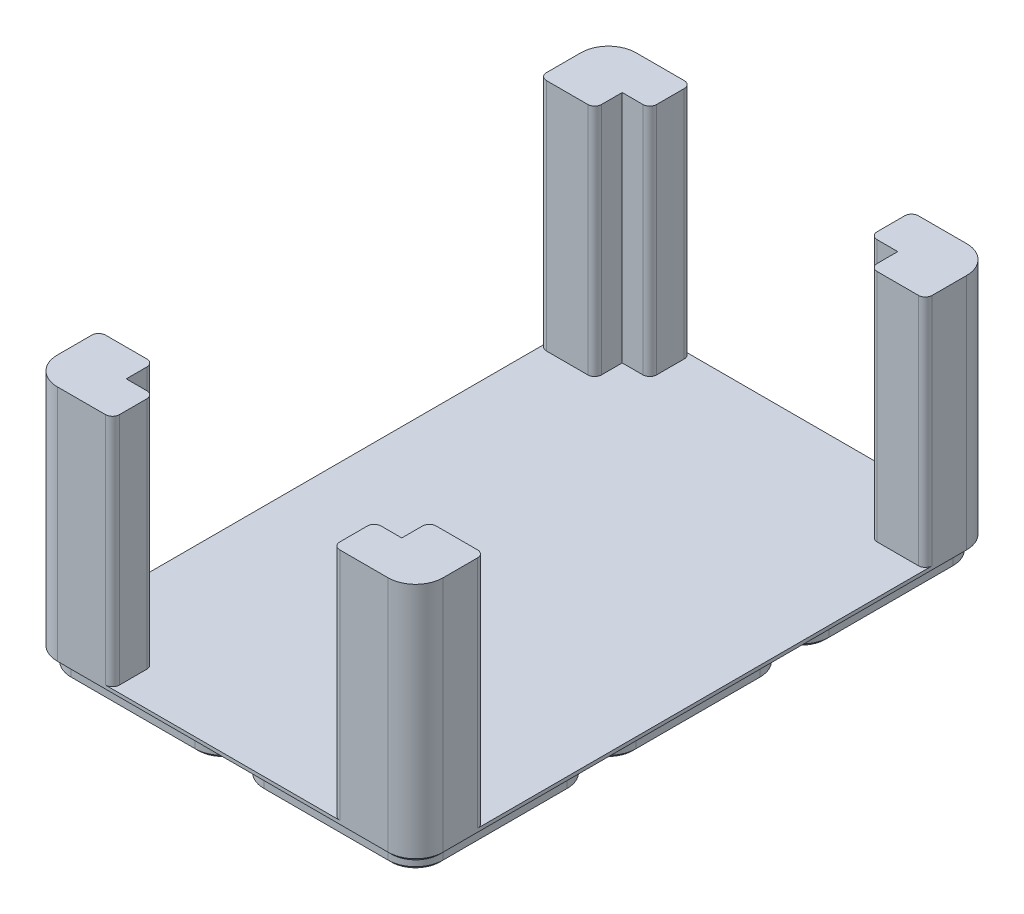
from build123d import *

# Parameters (mm, degrees)
BOSS_EXTRUDE4_DEPTH = 5
SKETCH7_R           = 3
CUT_EXTRUDE4_DEPTH  = 2
SKETCH8_W           = 70
SKETCH8_H           = 70
BOSS_EXTRUDE5_DEPTH = 30
MIRROR2_START       = 5
MIRROR2_OUTLINE_W   = 70
MIRROR2_OUTLINE_H   = 70
MIRROR2_DEPTH       = 30
MIRROR2_2_OUTLINE_R = 3
MIRROR2_2_DEPTH     = 5
MIRROR2_START_2     = 2
MIRROR2_3_OUTLINE_R = 3
MIRROR2_3_DEPTH     = 3
FILLET1_R           = 10
CUT_EXTRUDE5_DEPTH  = 30
BOSS_EXTRUDE6_DEPTH = 2.5
SKETCH17_W          = 199.861960995
SKETCH17_H          = 221.500559134
CUT_EXTRUDE10_DEPTH = 27.5
BOSS_EXTRUDE8_DEPTH = 2.5
BOSS_EXTRUDE9_DEPTH = 85
CHAMFER1_SIZE       = 1.25


# Read off the part's stored shape, not the designer's step: Mirror2
with BuildPart() as part:
    # Sketch5 → Boss-Extrude4 (new body)
    with BuildSketch(Plane(origin=(0, 0, 0), x_dir=(1, 0, 0), z_dir=(0, 1, 0))):
        with BuildLine():
            Line((-22.5, -32.5), (22.5, -32.5))
            ThreePointArc((22.5, -32.5), (29.571067812, -29.571067812), (32.5, -22.5))
            Line((32.5, -22.5), (32.5, 22.5))
            ThreePointArc((32.5, 22.5), (29.571067812, 29.571067812), (22.5, 32.5))
            Line((22.5, 32.5), (-22.5, 32.5))
            ThreePointArc((-22.5, 32.5), (-29.571067812, 29.571067812), (-32.5, 22.5))
            Line((-32.5, 22.5), (-32.5, -22.5))
            ThreePointArc((-32.5, -22.5), (-29.571067812, -29.571067812), (-22.5, -32.5))
        make_face()
    extrude(amount=BOSS_EXTRUDE4_DEPTH)

    # Sketch7 → Cut-Extrude4 (cut)
    with BuildSketch(Plane.XZ):
        with Locations(Location((-26.035533906, 26.035533906, 0), (0, 0, 270))):
            Circle(SKETCH7_R)
        with Locations(Location((26.036533906, 26.036533906, 0), (0, 0, 270))):
            Circle(SKETCH7_R)
        with Locations(Location((26.037533906, -26.035533906, 0), (0, 0, 270))):
            Circle(SKETCH7_R)
        with Locations(Location((-26.034533906, -26.036533906, 0), (0, 0, 270))):
            Circle(SKETCH7_R)
    extrude(amount=-CUT_EXTRUDE4_DEPTH, mode=Mode.SUBTRACT)

    # Sketch8 → Boss-Extrude5 (add)
    with BuildSketch(Plane(origin=(0, 5, 0), x_dir=(1, 0, 0), z_dir=(0, 1, 0))):
        Rectangle(SKETCH8_W, SKETCH8_H)
    extrude(amount=BOSS_EXTRUDE5_DEPTH)

    # Mirror2 outline → Mirror2 (add)
    with BuildSketch(Plane(origin=(0, 0, 0), x_dir=(1, 0, 0), z_dir=(0, 1, 0)).offset(MIRROR2_START)):
        with Locations((0, -70)):
            Rectangle(MIRROR2_OUTLINE_W, MIRROR2_OUTLINE_H)
        with Locations((0, 70)):
            Rectangle(MIRROR2_OUTLINE_W, MIRROR2_OUTLINE_H)
    extrude(amount=MIRROR2_DEPTH)

    # Mirror2 2 outline → Mirror2 2 (add)
    # profile 1 of 2: a face of its own
    with BuildSketch(Plane(origin=(0, 0, 0), x_dir=(1, 0, 0), z_dir=(0, 1, 0))):
        with BuildLine():
            Line((32.5, -92.5), (32.5, -47.5))
            ThreePointArc((32.5, -47.5), (29.571067812, -40.428932188), (22.5, -37.5))
            Line((22.5, -37.5), (-22.5, -37.5))
            ThreePointArc((-22.5, -37.5), (-29.571067812, -40.428932188), (-32.5, -47.5))
            Line((-32.5, -47.5), (-32.5, -92.5))
            ThreePointArc((-32.5, -92.5), (-29.571067812, -99.571067812), (-22.5, -102.5))
            Line((-22.5, -102.5), (22.5, -102.5))
            ThreePointArc((22.5, -102.5), (29.571067812, -99.571067812), (32.5, -92.5))
        make_face()
        with Locations((-26.034533906, -96.036533906)):
            Circle(MIRROR2_2_OUTLINE_R, mode=Mode.SUBTRACT)
        with Locations((-26.035533906, -43.964466094)):
            Circle(MIRROR2_2_OUTLINE_R, mode=Mode.SUBTRACT)
        with Locations((26.037533906, -96.035533906)):
            Circle(MIRROR2_2_OUTLINE_R, mode=Mode.SUBTRACT)
        with Locations((26.036533906, -43.963466094)):
            Circle(MIRROR2_2_OUTLINE_R, mode=Mode.SUBTRACT)
    # profile 2 of 2: a face of its own
    with BuildSketch(Plane(origin=(0, 0, 0), x_dir=(1, 0, 0), z_dir=(0, 1, 0))):
        with BuildLine():
            Line((32.5, 47.5), (32.5, 92.5))
            ThreePointArc((32.5, 92.5), (29.571067812, 99.571067812), (22.5, 102.5))
            Line((22.5, 102.5), (-22.5, 102.5))
            ThreePointArc((-22.5, 102.5), (-29.571067812, 99.571067812), (-32.5, 92.5))
            Line((-32.5, 92.5), (-32.5, 47.5))
            ThreePointArc((-32.5, 47.5), (-29.571067812, 40.428932188), (-22.5, 37.5))
            Line((-22.5, 37.5), (22.5, 37.5))
            ThreePointArc((22.5, 37.5), (29.571067812, 40.428932188), (32.5, 47.5))
        make_face()
        with Locations((-26.034533906, 43.963466094)):
            Circle(MIRROR2_2_OUTLINE_R, mode=Mode.SUBTRACT)
        with Locations((-26.035533906, 96.035533906)):
            Circle(MIRROR2_2_OUTLINE_R, mode=Mode.SUBTRACT)
        with Locations((26.037533906, 43.964466094)):
            Circle(MIRROR2_2_OUTLINE_R, mode=Mode.SUBTRACT)
        with Locations((26.036533906, 96.036533906)):
            Circle(MIRROR2_2_OUTLINE_R, mode=Mode.SUBTRACT)
    extrude(amount=MIRROR2_2_DEPTH)

    # Mirror2 3 outline → Mirror2 3 (add)
    with BuildSketch(Plane(origin=(0, 0, 0), x_dir=(1, 0, 0), z_dir=(0, 1, 0)).offset(MIRROR2_START_2)):
        with Locations((-26.035533906, -43.964466094)):
            Circle(MIRROR2_3_OUTLINE_R)
        with Locations((26.036533906, -43.963466094)):
            Circle(MIRROR2_3_OUTLINE_R)
        with Locations((26.037533906, -96.035533906)):
            Circle(MIRROR2_3_OUTLINE_R)
        with Locations((-26.034533906, -96.036533906)):
            Circle(MIRROR2_3_OUTLINE_R)
        with Locations((-26.035533906, 96.035533906)):
            Circle(MIRROR2_3_OUTLINE_R)
        with Locations((26.036533906, 96.036533906)):
            Circle(MIRROR2_3_OUTLINE_R)
        with Locations((26.037533906, 43.964466094)):
            Circle(MIRROR2_3_OUTLINE_R)
        with Locations((-26.034533906, 43.963466094)):
            Circle(MIRROR2_3_OUTLINE_R)
    extrude(amount=MIRROR2_3_DEPTH)

    # Fillet1
    fillet1_edges = [part.edges().sort_by_distance(p)[0] for p in [
        (35, 20, 105),
        (-35, 20, 105),
        (-35, 20, -105),
        (35, 20, -105),
    ]]
    fillet(fillet1_edges, radius=FILLET1_R)

    # Sketch9 → Cut-Extrude5 (cut)
    with BuildSketch(Plane(origin=(0, 35, 0), x_dir=(1, 0, 0), z_dir=(0, 1, 0))):
        with BuildLine():
            Line((-32.5, 95), (-32.5, -95))
            ThreePointArc((-32.5, -95), (-30.303300859, -100.303300859), (-25, -102.5))
            Line((-25, -102.5), (25, -102.5))
            ThreePointArc((25, -102.5), (30.303300859, -100.303300859), (32.5, -95))
            Line((32.5, -95), (32.5, 95))
            ThreePointArc((32.5, 95), (30.303300859, 100.303300859), (25, 102.5))
            Line((25, 102.5), (-25, 102.5))
            ThreePointArc((-25, 102.5), (-30.303300859, 100.303300859), (-32.5, 95))
        make_face()
    extrude(amount=-CUT_EXTRUDE5_DEPTH, mode=Mode.SUBTRACT)


with BuildPart() as cut_extrude5_piece_1:
    # of the separate pieces the step leaves, piece 1, a body of its own (cut_extrude5_pieces)
    add(part.part.solids().sort_by_distance((35, 5, 95))[0])



with BuildPart() as cut_extrude5_piece_2:
    # of the separate pieces the step leaves, piece 2, a body of its own (cut_extrude5_pieces)
    add(part.part.solids().sort_by_distance((32.5, 0, 92.5))[0])


with BuildPart() as cut_extrude5_piece_3:
    # of the separate pieces the step leaves, piece 3, a body of its own (cut_extrude5_pieces)
    add(part.part.solids().sort_by_distance((32.5, 0, -47.5))[0])


with BuildPart() as cut_extrude5_piece_4:
    # of the separate pieces the step leaves, piece 4, a body of its own (cut_extrude5_pieces)
    add(part.part.solids().sort_by_distance((32.5, 0, 22.5))[0])


with BuildPart() as cut_extrude5_piece_1_1:
    add(cut_extrude5_piece_1.part)

    add(cut_extrude5_piece_2.part)  # Boss-Extrude6 merges Cut-Extrude5 piece 2

    add(cut_extrude5_piece_3.part)  # Boss-Extrude6 merges Cut-Extrude5 piece 3

    add(cut_extrude5_piece_4.part)  # Boss-Extrude6 merges Cut-Extrude5 piece 4
    # Sketch10 → Boss-Extrude6 (add)
    with BuildSketch(Plane.XZ.offset(-5)):
        with BuildLine():
            Line((25, 105), (-25, 105))
            ThreePointArc((-25, 105), (-32.071067812, 102.071067812), (-35, 95))
            Line((-35, 95), (-35, -95))
            ThreePointArc((-35, -95), (-32.071067812, -102.071067812), (-25, -105))
            Line((-25, -105), (25, -105))
            ThreePointArc((25, -105), (32.071067812, -102.071067812), (35, -95))
            Line((35, -95), (35, 95))
            ThreePointArc((35, 95), (32.071067812, 102.071067812), (25, 105))
        make_face()
    extrude(amount=-BOSS_EXTRUDE6_DEPTH)

    # Mirror5: Cut-Extrude5 piece 1 across plane


with BuildPart() as cut_extrude5_piece_1_2:
    add(cut_extrude5_piece_1_1.part)
    add(cut_extrude5_piece_1_1.part.mirror(Plane.ZY.offset(35)))

    # Sketch17 → Cut-Extrude10 (cut)
    with BuildSketch(Plane(origin=(0, 35, 0), x_dir=(1, 0, 0), z_dir=(0, 1, 0))):
        with Locations((-34.704928208, 0)):
            Rectangle(SKETCH17_W, SKETCH17_H)
    extrude(amount=-CUT_EXTRUDE10_DEPTH, mode=Mode.SUBTRACT)

    # Sketch18 → Boss-Extrude8 (add)
    with BuildSketch(Plane(origin=(0, 7.5, 0), x_dir=(1, 0, 0), z_dir=(0, 1, 0))):
        Polygon((-45, -105), (-25, -105), (-25, 95), (-25, 105), (-45, 105), (-45, 95), align=None)
    extrude(amount=-BOSS_EXTRUDE8_DEPTH)

    # Sketch20 → Boss-Extrude9 (add)
    with BuildSketch(Plane(origin=(0, 7.5, 0), x_dir=(1, 0, 0), z_dir=(0, 1, 0))):
        with BuildLine():
            Line((-105, 95), (-105, 82.5))
            ThreePointArc((-105, 82.5), (-104.267766953, 80.732233047), (-102.5, 80))
            Line((-102.5, 80), (-87.5, 80))
            ThreePointArc((-87.5, 80), (-85.732233047, 80.732233047), (-85, 82.5))
            Line((-85, 82.5), (-85, 90))
            Line((-85, 90), (-77.5, 90))
            ThreePointArc((-77.5, 90), (-75.732233047, 90.732233047), (-75, 92.5))
            Line((-75, 92.5), (-75, 102.5))
            ThreePointArc((-75, 102.5), (-75.732233047, 104.267766953), (-77.5, 105))
            Line((-77.5, 105), (-95, 105))
            ThreePointArc((-95, 105), (-102.071067812, 102.071067812), (-105, 95))
        make_face()
        with BuildLine():
            Line((32.5, 80), (17.5, 80))
            ThreePointArc((17.5, 80), (15.732233047, 80.732233047), (15, 82.5))
            Line((15, 82.5), (15, 90))
            Line((15, 90), (7.5, 90))
            ThreePointArc((7.5, 90), (5.732233047, 90.732233047), (5, 92.5))
            Line((5, 92.5), (5, 102.5))
            ThreePointArc((5, 102.5), (5.732233047, 104.267766953), (7.5, 105))
            Line((7.5, 105), (25, 105))
            ThreePointArc((25, 105), (32.071067812, 102.071067812), (35, 95))
            Line((35, 95), (35, 82.5))
            ThreePointArc((35, 82.5), (34.267766953, 80.732233047), (32.5, 80))
        make_face()
        with BuildLine():
            Line((35, -95), (35, -82.5))
            ThreePointArc((35, -82.5), (34.267766953, -80.732233047), (32.5, -80))
            Line((32.5, -80), (17.5, -80))
            ThreePointArc((17.5, -80), (15.732233047, -80.732233047), (15, -82.5))
            Line((15, -82.5), (15, -90))
            Line((15, -90), (7.5, -90))
            ThreePointArc((7.5, -90), (5.732233047, -90.732233047), (5, -92.5))
            Line((5, -92.5), (5, -102.5))
            ThreePointArc((5, -102.5), (5.732233047, -104.267766953), (7.5, -105))
            Line((7.5, -105), (25, -105))
            ThreePointArc((25, -105), (32.071067812, -102.071067812), (35, -95))
        make_face()
        with BuildLine():
            Line((-102.5, -80), (-87.5, -80))
            ThreePointArc((-87.5, -80), (-85.732233047, -80.732233047), (-85, -82.5))
            Line((-85, -82.5), (-85, -90))
            Line((-85, -90), (-77.5, -90))
            ThreePointArc((-77.5, -90), (-75.732233047, -90.732233047), (-75, -92.5))
            Line((-75, -92.5), (-75, -102.5))
            ThreePointArc((-75, -102.5), (-75.732233047, -104.267766953), (-77.5, -105))
            Line((-77.5, -105), (-95, -105))
            ThreePointArc((-95, -105), (-102.071067812, -102.071067812), (-105, -95))
            Line((-105, -95), (-105, -82.5))
            ThreePointArc((-105, -82.5), (-104.267766953, -80.732233047), (-102.5, -80))
        make_face()
    extrude(amount=BOSS_EXTRUDE9_DEPTH)

    # Chamfer1
    chamfer1_edges = [cut_extrude5_piece_1_2.edges().sort_by_distance(p)[0] for p in [
        (35, 5, 0),
        (-29.571067812, 0, 40.428932188),
        (0, 0, 37.5),
        (29.571067812, 0, 40.428932188),
        (32.5, 0, 70),
        (29.571067812, 0, 99.571067812),
        (0, 0, 102.5),
        (-29.571067812, 0, 99.571067812),
        (-32.5, 0, 70),
        (-29.571067812, 0, 29.571067812),
        (0, 0, 32.5),
        (29.571067812, 0, 29.571067812),
        (32.5, 0, 0),
        (29.571067812, 0, -29.571067812),
        (0, 0, -32.5),
        (-29.571067812, 0, -29.571067812),
        (-32.5, 0, 0),
        (-105, 5, 0),
        (-102.071067812, 5, 102.071067812),
        (-102.071067812, 5, -102.071067812),
        (-37.5, 0, -70),
        (-40.428932188, 0, -40.428932188),
        (-70, 0, -37.5),
        (-99.571067812, 0, -40.428932188),
        (-102.5, 0, -70),
        (-99.571067812, 0, -99.571067812),
        (-70, 0, -102.5),
        (-40.428932188, 0, -99.571067812),
        (-37.5, 0, 70),
        (-40.428932188, 0, 99.571067812),
        (-70, 0, 102.5),
        (-99.571067812, 0, 99.571067812),
        (-102.5, 0, 70),
        (-99.571067812, 0, 40.428932188),
        (-70, 0, 37.5),
        (-40.428932188, 0, 40.428932188),
        (-40.428932188, 0, 29.571067812),
        (-70, 0, 32.5),
        (-99.571067812, 0, 29.571067812),
        (-102.5, 0, 0),
        (-99.571067812, 0, -29.571067812),
        (-70, 0, -32.5),
        (-40.428932188, 0, -29.571067812),
        (-37.5, 0, 0),
        (-35, 5, 105),
        (-35, 5, -105),
        (32.071067812, 5, -102.071067812),
        (32.071067812, 5, 102.071067812),
        (-29.571067812, 0, -99.571067812),
        (0, 0, -102.5),
        (29.571067812, 0, -99.571067812),
        (32.5, 0, -70),
        (29.571067812, 0, -40.428932188),
        (0, 0, -37.5),
        (-29.571067812, 0, -40.428932188),
        (-32.5, 0, -70),
    ]]
    chamfer(chamfer1_edges, length=CHAMFER1_SIZE)


solid = cut_extrude5_piece_1_2.part
